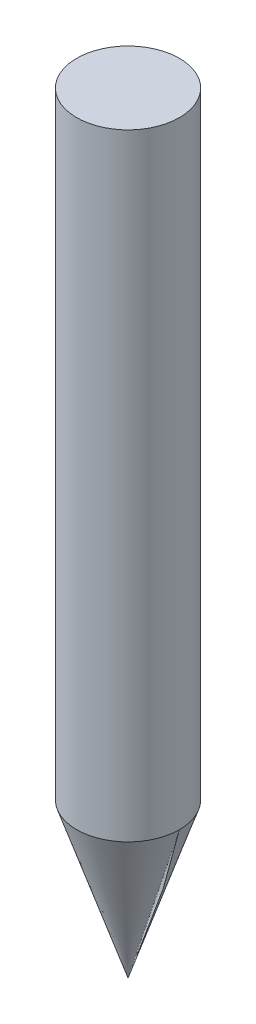
from build123d import *

# Parameters (mm, degrees)
REVOLVE1_ANGLE = 359.999695921


with BuildPart() as part:
    # Sketch1 → Revolve1 (revolve)
    with BuildSketch(Plane.XY):
        Polygon((0, 0), (4, 12), (4, 60), (0, 60), align=None)
    revolve(axis=Axis((0, 0, 0), (0, 1, 0)), revolution_arc=REVOLVE1_ANGLE)


solid = part.part
